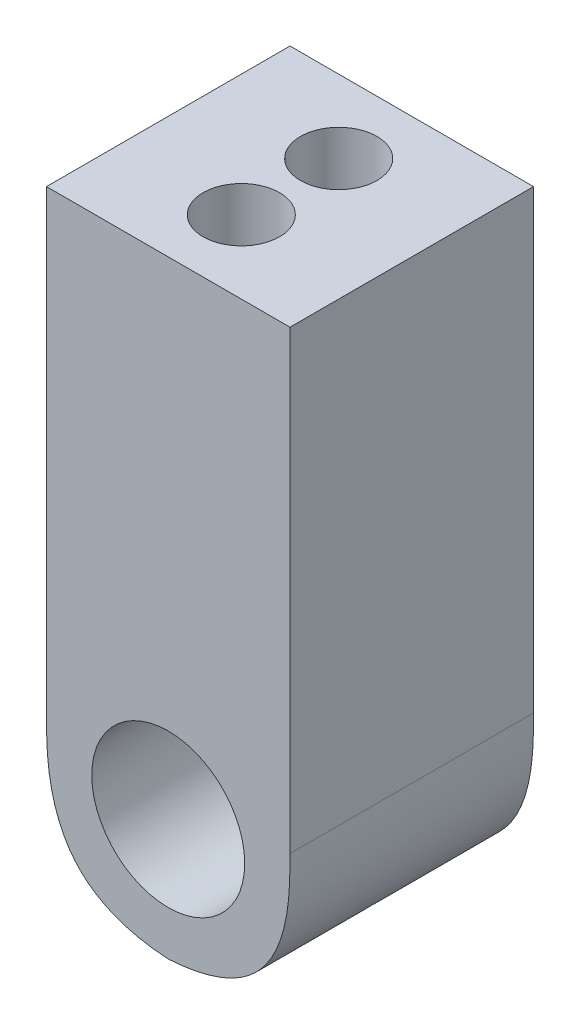
from build123d import *

# Parameters (mm, degrees)
SKETCH1_W           = 12.7
SKETCH1_H           = 19.05
SKETCH1_H_2         = 12.7
SKETCH1_R           = 3.9878
BOSS_EXTRUDE1_DEPTH = 12.7
FILLET1_SIZE        = 7.9756
CUT_EXTRUDE2_DEPTH  = 6.35
SKETCH1_3_R         = 3.9878
CUT_EXTRUDE3_DEPTH  = 6.35


with BuildPart() as part:
    # Sketch1 → Boss-Extrude1 (new body)
    # profile 1 of 3: a face of its own
    with BuildSketch(Plane.XY):
        with Locations((0, 15.875)):
            Rectangle(SKETCH1_W, SKETCH1_H)
    # profile 2 of 3: a face of its own
    with BuildSketch(Plane.XY):
        Rectangle(SKETCH1_W, SKETCH1_H_2)
        Circle(SKETCH1_R, mode=Mode.SUBTRACT)
    # profile 3 of 3: a face of its own
    with BuildSketch(Plane.XY):
        Circle(SKETCH1_R)
    extrude(amount=-BOSS_EXTRUDE1_DEPTH)

    # Fillet1
    # a fillet whose section is not a circle: 7.9756 mm, written as the material it takes off along each edge
    with BuildSketch(Plane(origin=(-6.35, -6.35, 19.939), x_dir=(1, 0, 0), z_dir=(0, 0, -1)), Plane(origin=(6.35, -6.35, 19.939), x_dir=(0, 1, 0), z_dir=(0, 0, -1))) as fillet1_piece_1:
        with BuildLine():
            add(Edge.make_bspline([(FILLET1_SIZE, 0), (FILLET1_SIZE * 0.831801948466, 0), (FILLET1_SIZE * 0.663603896932, 0), (FILLET1_SIZE * 0.292893218813, -FILLET1_SIZE * 0.0716919198361), (FILLET1_SIZE * 0.0716919198361, -FILLET1_SIZE * 0.292893218813), (0, -FILLET1_SIZE * 0.663603896932), (0, -FILLET1_SIZE * 0.831801948466), (0, -FILLET1_SIZE)], knots=[0, 0, 0, 0, 0, 0, 0.5, 0.5, 1, 1, 1, 1, 1, 1], degree=5))
            Line((0, -FILLET1_SIZE), (0, 0))
            Line((0, 0), (FILLET1_SIZE, 0))
        make_face()
    extrude(amount=52.578, mode=Mode.SUBTRACT)

    # Sketch3 → Cut-Extrude2 (cut)
    with BuildSketch(Plane(origin=(0, 25.4, 0), x_dir=(1, 0, 0), z_dir=(0, 1, 0))):
        with BuildLine():
            ThreePointArc((1.9939, 8.89), (1.409900211, 10.299900211), (0, 10.8839))
            Line((0, 10.8839), (0, 8.89))
            Line((0, 8.89), (1.9939, 8.89))
        make_face()
        with BuildLine():
            Line((0, 8.89), (0, 10.8839))
            ThreePointArc((0, 10.8839), (-1.409900211, 10.299900211), (-1.9939, 8.89))
            Line((-1.9939, 8.89), (0, 8.89))
        make_face()
        with BuildLine():
            Line((1.9939, 8.89), (0, 8.89))
            Line((0, 8.89), (0, 6.8961))
            ThreePointArc((0, 6.8961), (1.409900211, 7.480099789), (1.9939, 8.89))
        make_face()
        with BuildLine():
            Line((0, 6.8961), (0, 8.89))
            Line((0, 8.89), (-1.9939, 8.89))
            ThreePointArc((-1.9939, 8.89), (-1.409900211, 7.480099789), (0, 6.8961))
        make_face()
        with BuildLine():
            ThreePointArc((1.9939, 3.81), (1.409900211, 5.219900211), (0, 5.8039))
            Line((0, 5.8039), (0, 3.81))
            Line((0, 3.81), (1.9939, 3.81))
        make_face()
        with BuildLine():
            Line((0, 3.81), (0, 5.8039))
            ThreePointArc((0, 5.8039), (-1.409900211, 5.219900211), (-1.9939, 3.81))
            Line((-1.9939, 3.81), (0, 3.81))
        make_face()
        with BuildLine():
            ThreePointArc((0, 1.8161), (1.409900211, 2.400099789), (1.9939, 3.81))
            Line((1.9939, 3.81), (0, 3.81))
            Line((0, 3.81), (0, 1.8161))
        make_face()
        with BuildLine():
            Line((0, 3.81), (-1.9939, 3.81))
            ThreePointArc((-1.9939, 3.81), (-1.409900211, 2.400099789), (0, 1.8161))
            Line((0, 1.8161), (0, 3.81))
        make_face()
    extrude(amount=-CUT_EXTRUDE2_DEPTH, mode=Mode.SUBTRACT)

    # Sketch1<3> → Cut-Extrude3 (cut)
    with BuildSketch(Plane.XY):
        Circle(SKETCH1_3_R)
    extrude(amount=-CUT_EXTRUDE3_DEPTH, mode=Mode.SUBTRACT)


solid = part.part
